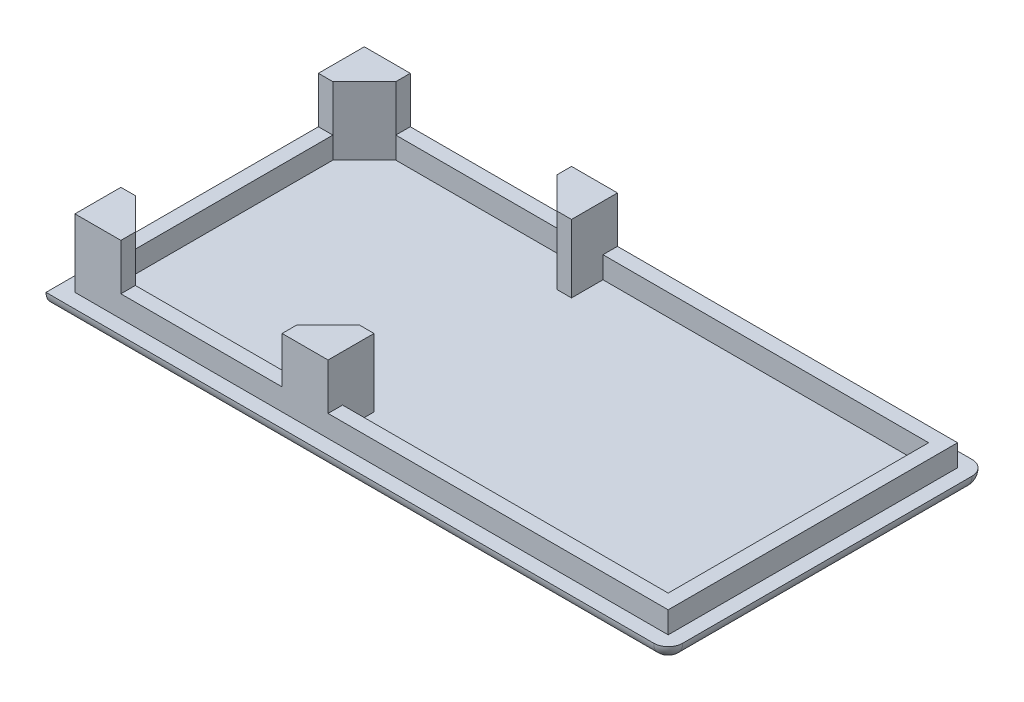
from build123d import *

# Parameters (mm, degrees)
SKETCH1_W                = 43
SKETCH1_H                = 1
BOSS_EXTRUDE1_DEPTH      = 22
FILLET1_R                = 1
SKETCH2_W                = 41
SKETCH2_H                = 20
SKETCH2_W_2              = 39
SKETCH2_H_2              = 18
BOSS_EXTRUDE2_DEPTH      = 1.5
BOSS_EXTRUDE3_DEPTH      = 3.199
BOSS_EXTRUDE3_DEPTH_BACK = 1.5


with BuildPart() as part:
    # Sketch1 → Boss-Extrude1 (new body)
    with BuildSketch(Plane.XY):
        with Locations((21.5, 0.5)):
            Rectangle(SKETCH1_W, SKETCH1_H)
    extrude(amount=BOSS_EXTRUDE1_DEPTH)

    # Fillet1
    # the kernel refuses this fillet: 1 mm, written as the material it takes off along each edge
    with BuildSketch(Plane(origin=(42, 1, 21), x_dir=(1, 0, 0), z_dir=(0, -1, 0))) as fillet1_piece_1_section:
        Polygon((0, 0), (FILLET1_R * 1.02, 0), (FILLET1_R * 1.02, FILLET1_R * 1.02), (0, FILLET1_R * 1.02), align=None)
    fillet1_piece_1 = extrude(amount=FILLET1_R * 1.02, mode=Mode.PRIVATE)
    fillet1_piece_1 = fillet1_piece_1 - Plane(origin=(42, 1, 21), x_dir=(-0.7071067811865475, 0, -0.7071067811865475), z_dir=(0, -1, 0)) * Sphere(FILLET1_R, mode=Mode.PRIVATE)
    add(fillet1_piece_1, mode=Mode.SUBTRACT)
    with BuildSketch(Plane(origin=(42, 1, 1), x_dir=(1, 0, 0), z_dir=(0, -1, 0))) as fillet1_piece_2_section:
        Polygon((0, 0), (FILLET1_R * 1.02, 0), (FILLET1_R * 1.02, -FILLET1_R * 1.02), (0, -FILLET1_R * 1.02), align=None)
    fillet1_piece_2 = extrude(amount=FILLET1_R * 1.02, mode=Mode.PRIVATE)
    fillet1_piece_2 = fillet1_piece_2 - Plane(origin=(42, 1, 1), x_dir=(-0.7071067811865475, 0, 0.7071067811865475), z_dir=(0, -1, 0)) * Sphere(FILLET1_R, mode=Mode.PRIVATE)
    add(fillet1_piece_2, mode=Mode.SUBTRACT)
    with BuildSketch(Plane(origin=(-2.5, 0, 0), x_dir=(0, 0, 1), z_dir=(1, 0, 0))) as fillet1_piece_3:
        with BuildLine():
            CenterArc((FILLET1_R, -FILLET1_R), FILLET1_R, 90, 90)
            Line((0, -FILLET1_R), (0, 0))
            Line((0, 0), (FILLET1_R, 0))
        make_face()
    extrude(amount=44.5, mode=Mode.SUBTRACT)
    with BuildSketch(Plane(origin=(-2.5, 0, 22), x_dir=(0, 0, -1), z_dir=(1, 0, 0))) as fillet1_piece_4:
        with BuildLine():
            CenterArc((FILLET1_R, FILLET1_R), FILLET1_R, 180, 90)
            Line((0, FILLET1_R), (0, 0))
            Line((0, 0), (FILLET1_R, 0))
        make_face()
    extrude(amount=44.5, mode=Mode.SUBTRACT)
    with BuildSketch(Plane(origin=(43, 0, 1), x_dir=(-1, 0, 0), z_dir=(0, 0, 1))) as fillet1_piece_5:
        with BuildLine():
            CenterArc((FILLET1_R, -FILLET1_R), FILLET1_R, 90, 90)
            Line((0, -FILLET1_R), (0, 0))
            Line((0, 0), (FILLET1_R, 0))
        make_face()
    extrude(amount=20, mode=Mode.SUBTRACT)

    # Sketch2 → Boss-Extrude2 (add)
    with BuildSketch(Plane(origin=(0, 1, 0), x_dir=(1, 0, 0), z_dir=(0, 1, 0))):
        with Locations((21.5, -11)):
            Rectangle(SKETCH2_W, SKETCH2_H)
        with Locations((21.5, -11)):
            Rectangle(SKETCH2_W_2, SKETCH2_H_2, mode=Mode.SUBTRACT)
    extrude(amount=BOSS_EXTRUDE2_DEPTH)

    # Sketch3 → Boss-Extrude3 (add, two sides: drawn at the far end of the back side and taken through both)
    with BuildSketch(Plane(origin=(0, 2.5, 0), x_dir=(1, 0, 0), z_dir=(0, 1, 0)).offset(-BOSS_EXTRUDE3_DEPTH_BACK)):
        Polygon((1, -21), (4.175, -21), (4.175, -20), (2, -17.825), (1, -17.825), align=None)
        Polygon((1, -1), (1, -4.175), (2, -4.175), (4.175, -2), (4.175, -1), align=None)
        Polygon((18.494, -21), (18.494, -17.825), (17.494, -17.825), (15.319, -20), (15.319, -21), align=None)
        Polygon((18.494, -1), (18.494, -4.175), (17.494, -4.175), (15.319, -2), (15.319, -1), align=None)
    extrude(amount=BOSS_EXTRUDE3_DEPTH + BOSS_EXTRUDE3_DEPTH_BACK)


solid = part.part
